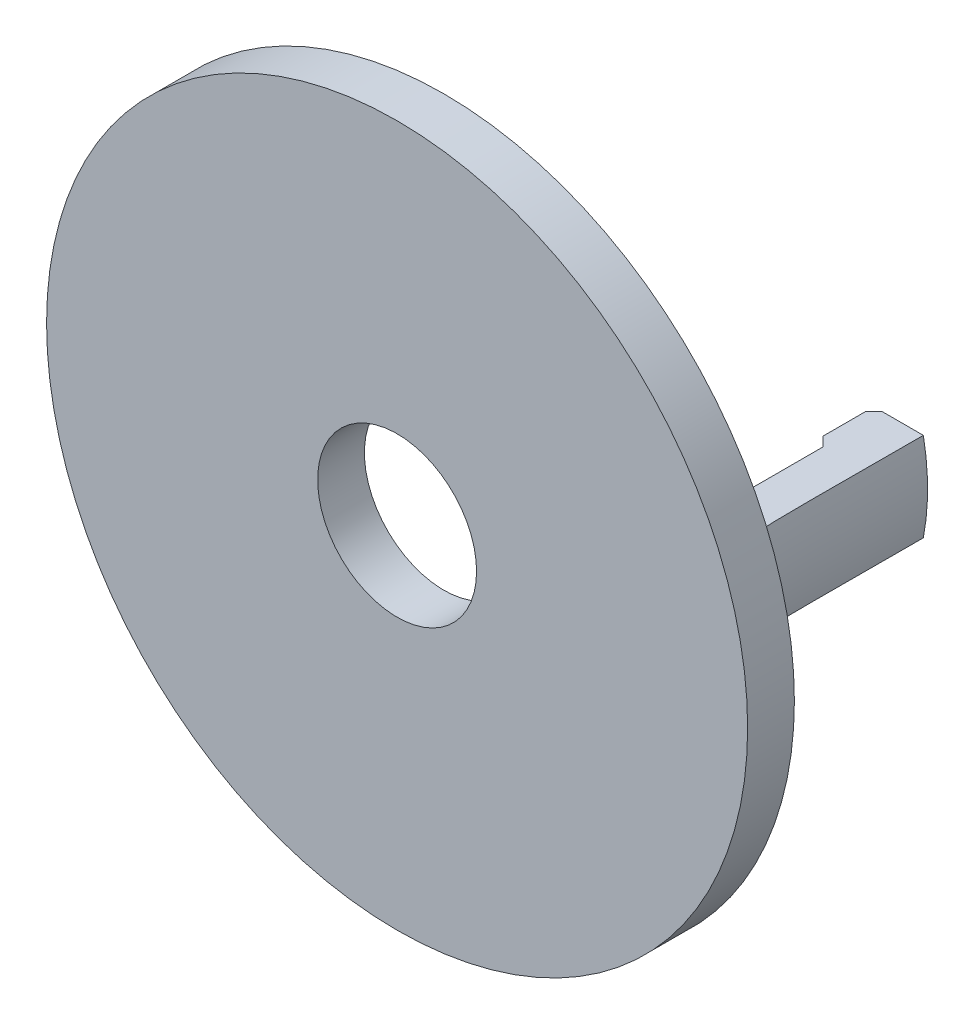
from build123d import *

# Parameters (mm, degrees)
SKETCH4_R           = 37.5
BOSS_EXTRUDE2_DEPTH = 5
SKETCH5_R           = 8.5
CUT_EXTRUDE1_DEPTH  = 54.268189382
BOSS_EXTRUDE3_DEPTH = 4.75
SKETCH1_R           = 37.5
CUT_EXTRUDE2_DEPTH  = 60.397495738


with BuildPart() as part:
    # Sketch4 → Boss-Extrude2 (new body)
    with BuildSketch(Plane.XY):
        Circle(SKETCH4_R)
    extrude(amount=BOSS_EXTRUDE2_DEPTH)

    # Sketch5 → Cut-Extrude1 (cut, through all)
    with BuildSketch(Plane.XY.offset(5)):
        Circle(SKETCH5_R)
    extrude(amount=-CUT_EXTRUDE1_DEPTH, mode=Mode.SUBTRACT)

    # Sketch6 → Boss-Extrude3 (add, symmetric)
    with BuildSketch(Plane(origin=(0, 0, 0), x_dir=(1, 0, 0), z_dir=(0, 1, 0))):
        Polygon((20.25, 2.896446609), (17.353553391, 0), (26.5, 0), (26.5, 26.75), (20.103553391, 26.75), (19.25, 25.896446609), (19.25, 21.310660172), (20.25, 20.310660172), align=None)
    boss_extrude3 = extrude(amount=BOSS_EXTRUDE3_DEPTH, both=True)

    # Sketch1 → Cut-Extrude2 (cut, through all)
    with BuildSketch(Plane.XY):
        Circle(SKETCH1_R)
        with BuildLine():
            ThreePointArc((-1, 26.481125354), (18.381376445, 19.088609169), (26.5, 0))
            ThreePointArc((26.5, 0), (18.381376445, -19.088609169), (-1, -26.481125354))
            ThreePointArc((-1, -26.481125354), (-28.5, 0), (-1, 26.481125354))
        make_face(mode=Mode.SUBTRACT)
    cut_extrude2 = extrude(amount=-CUT_EXTRUDE2_DEPTH, mode=Mode.SUBTRACT)

    # Sketch6<4> → Cut-Revolve1 (revolve, cut)
    with BuildSketch(Plane(origin=(0, 0, 0), x_dir=(1, 0, 0), z_dir=(0, 1, 0))):
        with BuildLine():
            add(Edge.make_bspline(
                [(25, 26.75), (25, 22.72818992), (24.990050178, 20.542467854), (25.01194908, 14.942357728), (24.774871471, 4.983935506), (26.5, 0)],
                knots=[0, 0, 0, 0, 0.44660472, 0.54660472, 1, 1, 1, 1], degree=3))
            Line((26.5, 0), (26.5, 26.75))
            Line((26.5, 26.75), (25, 26.75))
        make_face()
    cut_revolve1 = revolve(axis=Axis((0, 0, 0), (0, 0, -1)), mode=Mode.SUBTRACT)

    # Mirror1: Boss-Extrude3, Cut-Extrude2, Cut-Revolve1 across plane
    add(boss_extrude3.mirror(Plane(origin=(0, 0, 0), x_dir=(0, 0, 1), z_dir=(1, 0, 0))))
    add(cut_extrude2.mirror(Plane(origin=(0, 0, 0), x_dir=(0, 0, 1), z_dir=(1, 0, 0))), mode=Mode.SUBTRACT)
    add(cut_revolve1.mirror(Plane(origin=(0, 0, 0), x_dir=(0, 0, 1), z_dir=(1, 0, 0))), mode=Mode.SUBTRACT)


solid = part.part
